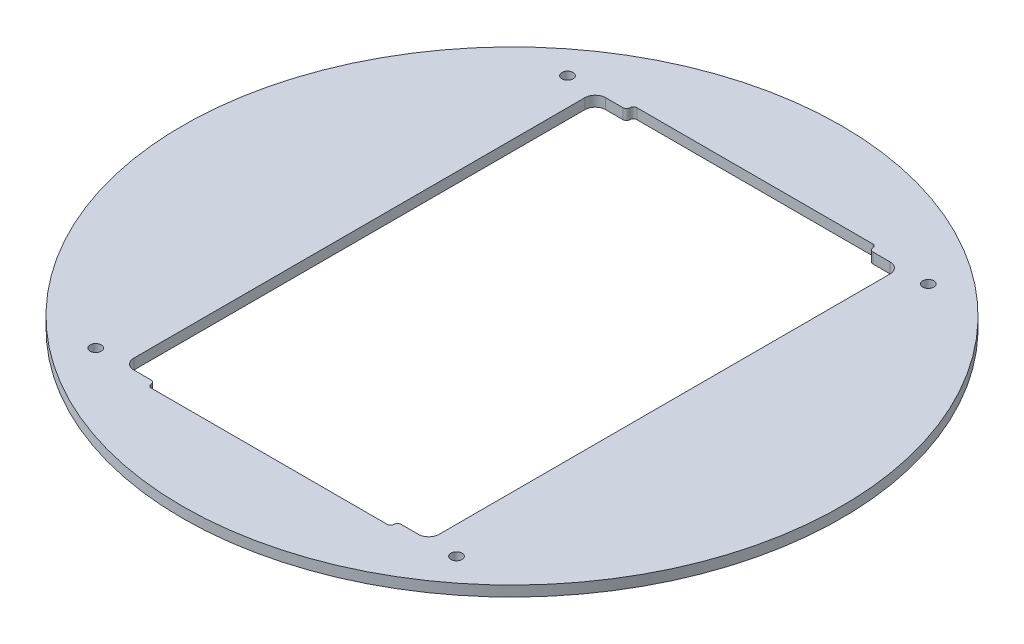
from build123d import *

# Parameters (mm, degrees)
SKIZZE1_R                       = 95
SKIZZE1_R_2                     = 1.6
AUFSATZ_LINEAR_AUSTRAGEN1_DEPTH = 3
SKIZZE2_W                       = 70
SKIZZE2_H                       = 4
SCHNITT_LINEAR_AUSTRAGEN2_DEPTH = 3
VERRUNDUNG1_R                   = 1


with BuildPart() as part:
    # Skizze1 → Aufsatz-Linear austragen1 (new body)
    with BuildSketch(Plane(origin=(0, 0, 0), x_dir=(1, 0, 0), z_dir=(0, 1, 0))):
        with Locations(Location((0, 0, 0), (0, 0, 270))):
            Circle(SKIZZE1_R)
        with Locations(Location((-52, 68, 0), (0, 0, 270))):
            Circle(SKIZZE1_R_2, mode=Mode.SUBTRACT)
        with Locations(Location((52, 68, 0), (0, 0, 270))):
            Circle(SKIZZE1_R_2, mode=Mode.SUBTRACT)
        with Locations(Location((-52, -68, 0), (0, 0, 270))):
            Circle(SKIZZE1_R_2, mode=Mode.SUBTRACT)
        with Locations(Location((52, -68, 0), (0, 0, 270))):
            Circle(SKIZZE1_R_2, mode=Mode.SUBTRACT)
        with BuildLine():
            Line((-44, 65), (-44, -65))
            ThreePointArc((-44, -65), (-43.121320344, -67.121320344), (-41, -68))
            Line((-41, -68), (41, -68))
            ThreePointArc((41, -68), (43.121320344, -67.121320344), (44, -65))
            Line((44, -65), (44, 65))
            ThreePointArc((44, 65), (43.121320344, 67.121320344), (41, 68))
            Line((41, 68), (-41, 68))
            ThreePointArc((-41, 68), (-43.121320344, 67.121320344), (-44, 65))
        make_face(mode=Mode.SUBTRACT)
    extrude(amount=AUFSATZ_LINEAR_AUSTRAGEN1_DEPTH)

    # Skizze2 → Schnitt-Linear austragen2 (cut)
    with BuildSketch(Plane(origin=(0, 0, 0), x_dir=(1, 0, 0), z_dir=(0, 1, 0))):
        with Locations((0, -68)):
            Rectangle(SKIZZE2_W, SKIZZE2_H)
        with Locations((0, 68)):
            Rectangle(SKIZZE2_W, SKIZZE2_H)
    extrude(amount=SCHNITT_LINEAR_AUSTRAGEN2_DEPTH, mode=Mode.SUBTRACT)

    # Verrundung1
    verrundung1_edges = [part.edges().sort_by_distance(p)[0] for p in [
        (-35, 1.5, 70),
        (35, 1.5, 70),
        (35, 1.5, -70),
        (-35, 1.5, -70),
    ]]
    fillet(verrundung1_edges, radius=VERRUNDUNG1_R)
    verrundung1_2_edges = [part.edges().sort_by_distance(p)[0] for p in [
        (-35, 1.5, 68),
        (35, 1.5, 68),
        (35, 1.5, -68),
        (-35, 1.5, -68),
    ]]
    fillet(verrundung1_2_edges, radius=VERRUNDUNG1_R - 0.0001)  # a hair under: the kernel refuses the full size


solid = part.part
